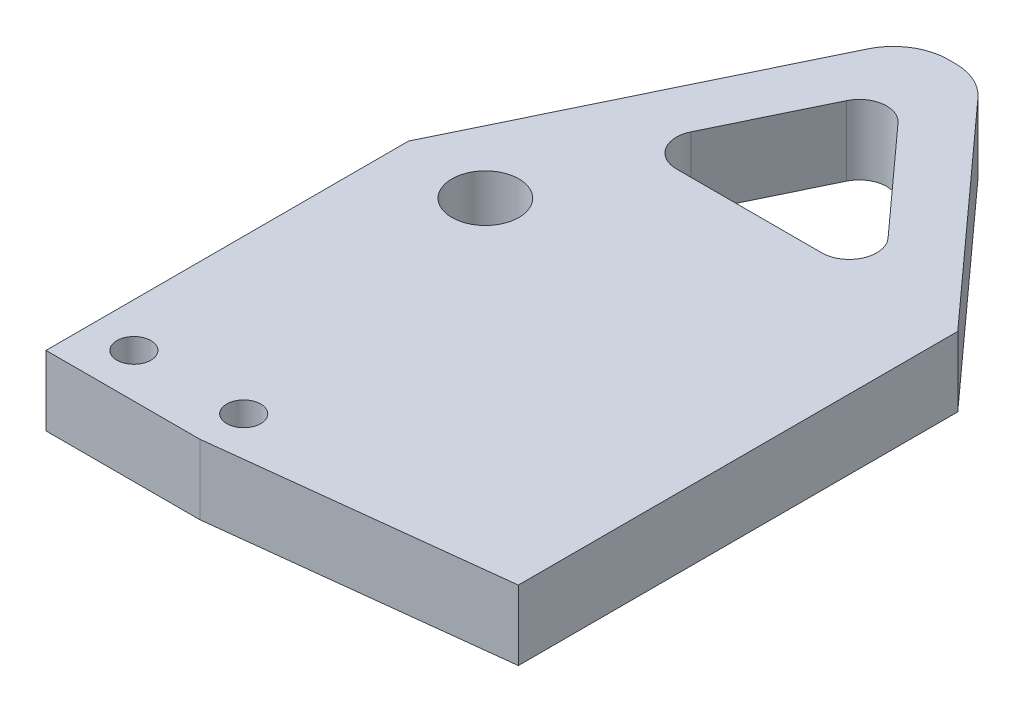
from build123d import *

# Parameters (mm, degrees)
SKETCH1_R           = 6.1
SKETCH1_R_2         = 3.1
BOSS_EXTRUDE1_DEPTH = 12.7
FILLET1_R           = 10
CUT_EXTRUDE1_DEPTH  = 147.442104601
FILLET2_R           = 5


with BuildPart() as part:
    # Sketch1 → Boss-Extrude1 (new body)
    with BuildSketch(Plane(origin=(0, 0, 0), x_dir=(1, 0, 0), z_dir=(0, 1, 0))):
        Polygon((-80, 0), (-80, 60), (-50, 122), (-38, 122), (0, 80), (0, 0), (-52, -6), (-80, -6), align=None)
        with Locations((-64, 58)):
            Circle(SKETCH1_R, mode=Mode.SUBTRACT)
        with Locations((-72, 2)):
            Circle(SKETCH1_R_2, mode=Mode.SUBTRACT)
        with Locations((-52, 2)):
            Circle(SKETCH1_R_2, mode=Mode.SUBTRACT)
    extrude(amount=BOSS_EXTRUDE1_DEPTH)

    # Fillet1
    fillet1_edges = [part.edges().sort_by_distance(p)[0] for p in [
        (-38, 6.35, -122),
        (-50, 6.35, -122),
    ]]
    fillet(fillet1_edges, radius=FILLET1_R)

    # Sketch3 → Cut-Extrude1 (cut, through all)
    with BuildSketch(Plane(origin=(0, 12.7, 0), x_dir=(1, 0, 0), z_dir=(0, 1, 0))):
        Polygon((-13.48552596, 80), (-43.279484559, 112.930164767), (-59.213435253, 80), align=None)
    extrude(amount=-CUT_EXTRUDE1_DEPTH, mode=Mode.SUBTRACT)

    # Fillet2
    fillet2_edges = [part.edges().sort_by_distance(p)[0] for p in [
        (-43.279484559, 6.35, -112.930164767),
        (-13.48552596, 6.35, -80),
        (-59.213435253, 6.35, -80),
    ]]
    fillet(fillet2_edges, radius=FILLET2_R)


solid = part.part
